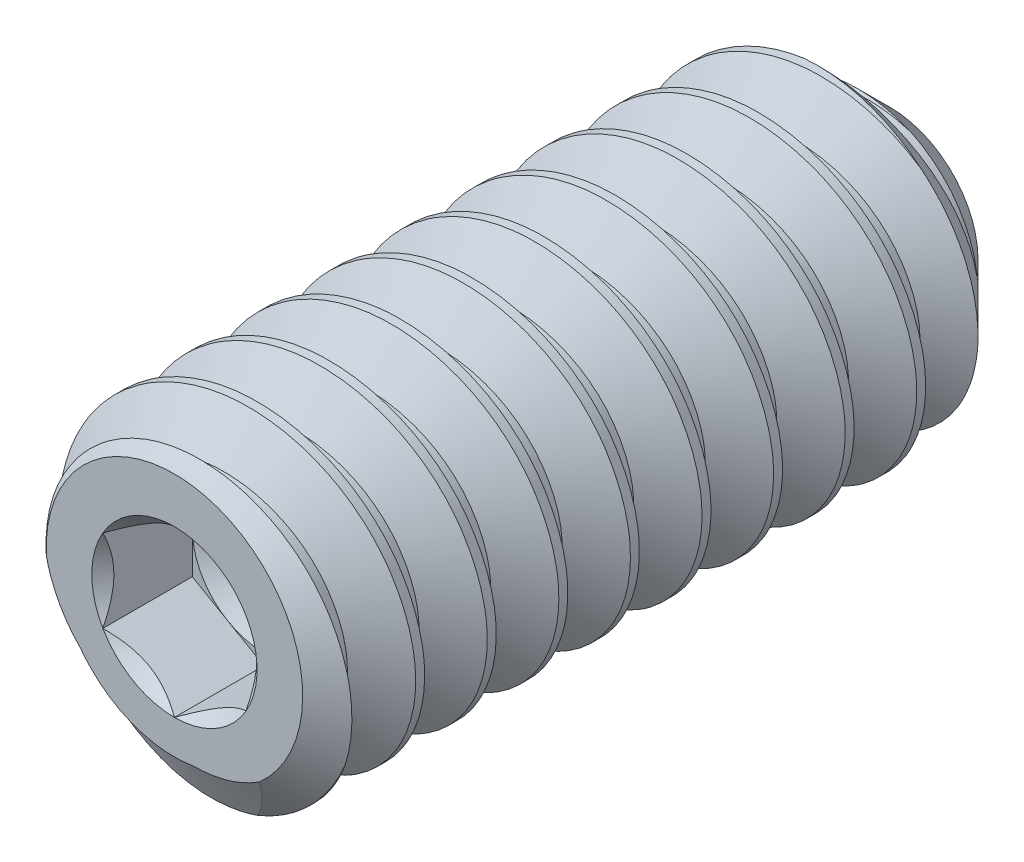
from build123d import *

# Parameters (mm, degrees)
CUT_SWEEP2_PITCH    = 0.635
CUT_EXTRUDE10_DEPTH = 0.79375


with BuildPart() as part:
    # Sketch22 → Revolve1 (revolve)
    with BuildSketch(Plane(origin=(0, 0, 0), x_dir=(0, 0, -1), z_dir=(1, 0, 0)), mode=Mode.PRIVATE) as revolve1_sk:
        Polygon((-2.940837021, 0), (-2.940837021, 1.13792), (-2.741641981, 1.4224), (2.766188262, 1.4224), (3.409162979, 0.779425283), (2.940837021, 0), align=None)
    revolve(revolve1_sk.sketch.rotate(Axis((0, 0, -2.940837021), (0, 0, -1)), 180), axis=Axis((0, 0, -2.940837021), (0, 0, -1)))

    # Cut-Sweep2: the profile of Sketch28 profile screwed along a right-hand helix of 11.4 turns, 6 arcs to a turn; built about Z, then put on its axis
    cut_sweep2_z = Axis((0, 0, 0), (0, 0, 1))
    cut_sweep2_corners = [(1.4227, 0, 0.000173205), (1.4227, 0, -0.555798205), (1.037451708, 0, -0.333375), (1.037451708, 0, -0.22225)]
    with BuildLine(mode=Mode.PRIVATE) as cut_sweep2_profile:
        Line(cut_sweep2_corners[0], cut_sweep2_corners[1])
        Line(cut_sweep2_corners[1], cut_sweep2_corners[2])
        Line(cut_sweep2_corners[2], cut_sweep2_corners[3])
        Line(cut_sweep2_corners[3], cut_sweep2_corners[0])
    cut_sweep2_cap = Face(cut_sweep2_profile.wire())
    cut_sweep2_turn_angles = [0, 30, 60, 90, 120, 150, 180, 210, 240, 270, 300, 330, 360]
    cut_sweep2_turn_weights = [1, 0.8660254037844387, 1, 0.8660254037844387, 1, 0.8660254037844387, 1, 0.8660254037844387, 1, 0.8660254037844387, 1, 0.8660254037844387, 1]
    cut_sweep2_turn_rails = [Edge.make_bspline([Vector(p[0], p[1], 0).rotate(cut_sweep2_z, cut_sweep2_turn_angles[k]) / cut_sweep2_turn_weights[k] + Vector(0, 0, p[2] + CUT_SWEEP2_PITCH * cut_sweep2_turn_angles[k] / 360) for k in range(13)], [0, 0, 0, 1, 1, 2, 2, 3, 3, 4, 4, 5, 5, 6, 6, 6], 2, cut_sweep2_turn_weights) for p in cut_sweep2_corners]
    cut_sweep2_turn_sides = [Face.make_surface_from_curves(cut_sweep2_turn_rails[p[0]], cut_sweep2_turn_rails[p[1]]) for p in [(0, 1), (1, 2), (2, 3), (3, 0)]]
    cut_sweep2_last_angles = [3960, 3990, 4020, 4050, 4080, 4092, 4104]
    cut_sweep2_last_weights = [1, 0.8660254037844387, 1, 0.8660254037844387, 1, 0.978147600733766, 1]
    cut_sweep2_last_rails = [Edge.make_bspline([Vector(p[0], p[1], 0).rotate(cut_sweep2_z, cut_sweep2_last_angles[k]) / cut_sweep2_last_weights[k] + Vector(0, 0, p[2] + CUT_SWEEP2_PITCH * cut_sweep2_last_angles[k] / 360) for k in range(7)], [0, 0, 0, 1, 1, 2, 2, 3, 3, 3], 2, cut_sweep2_last_weights) for p in cut_sweep2_corners]
    cut_sweep2_last_sides = [Face.make_surface_from_curves(cut_sweep2_last_rails[p[0]], cut_sweep2_last_rails[p[1]]) for p in [(0, 1), (1, 2), (2, 3), (3, 0)]]
    cut_sweep2 = Plane(origin=(0, 0, -3.409162979), x_dir=(0, 1, 0), z_dir=(0, 0, 1)) * Solid(Shell([*[p.moved(Location((0, 0, CUT_SWEEP2_PITCH * i))) for i in range(11) for p in cut_sweep2_turn_sides], *cut_sweep2_last_sides, cut_sweep2_cap, cut_sweep2_cap.rotate(cut_sweep2_z, 4104).moved(Location((0, 0, CUT_SWEEP2_PITCH * 4104 / 360)))]))
    add(cut_sweep2, mode=Mode.SUBTRACT)

    # Sketch23 → Cut-Extrude10 (cut)
    with BuildSketch(Plane.XY.offset(2.940837021)):
        Polygon((0, 0.733234842), (-0.635, 0.366617421), (-0.635, -0.366617421), (0, -0.733234842), (0.635, -0.366617421), (0.635, 0.366617421), align=None)
    extrude(amount=-CUT_EXTRUDE10_DEPTH, mode=Mode.SUBTRACT)

    # Cut-Extrude11 cone 1 section (through the dimple's axis) → Cut-Extrude11 (revolve, cut)
    with BuildSketch(Plane(origin=(0, 0, 2.940837021), x_dir=(0, -1, 0), z_dir=(1, 0, 0))):
        Polygon((0, 0), (0.733234842, 0), (0, 0.733234842), align=None)
    revolve(axis=Axis((0, 0, 2.940837021), (0, 0, -1)), mode=Mode.SUBTRACT)

    # Cut-Extrude12 cone 1 section (through the dimple's axis) → Cut-Extrude12 (revolve, cut)
    with BuildSketch(Plane(origin=(0, 0, 2.147087021), x_dir=(0, -1, 0), z_dir=(1, 0, 0))):
        Polygon((0, 0), (0.635, 0), (0, 0.366617421), align=None)
    revolve(axis=Axis((0, 0, 2.147087021), (0, 0, -1)), mode=Mode.SUBTRACT)


solid = part.part
